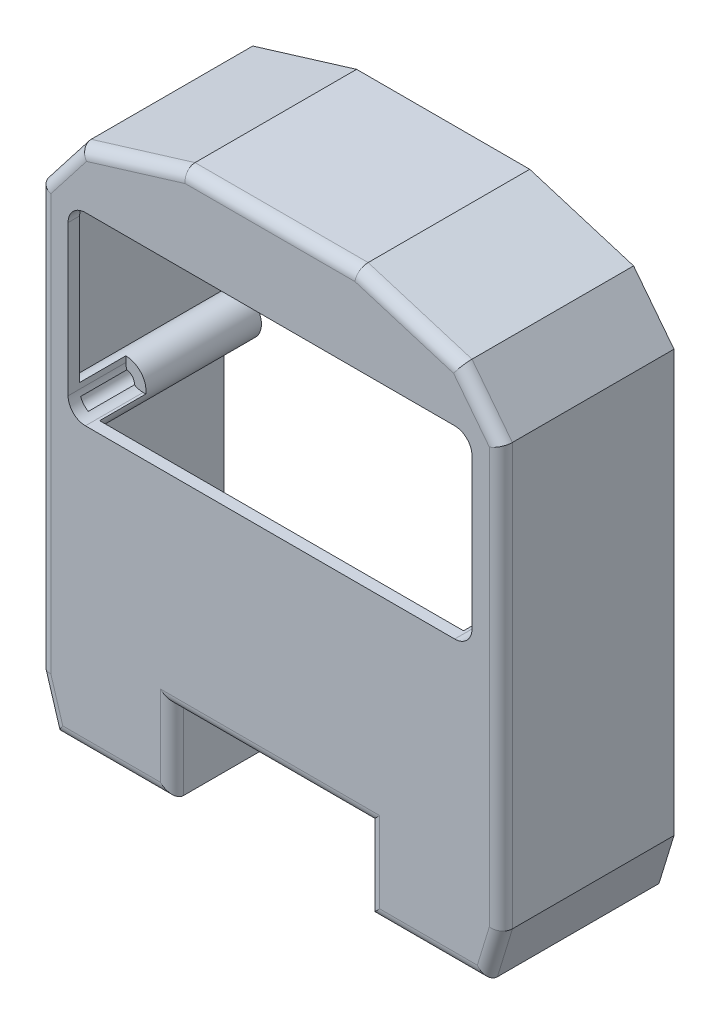
from build123d import *

# Parameters (mm, degrees)
EXTRUDE_1_DEPTH     = 30
FILLET_4_R          = 2
SKETCH_2_R          = 1.5
CUT_EXTRUDE_1_DEPTH = 28
SHELL_3_DEPTH       = 28
CUT_EXTRUDE_2_DEPTH = 10


# Read off the part's stored shape, not the designer's step: 抽壳3
with BuildPart() as part:
    # 草图1 → 凸台-拉伸1 (new body)
    with BuildSketch(Plane.XY):
        Polygon((-84.402777778, 44), (-87, 52.5), (-87, 125.5), (-80, 134.5), (-62, 140), (-32, 140), (-14, 134.5), (-7, 125.5), (-7, 52.5), (-9.597222222, 44), (-30, 44), (-30, 58), (-64, 58), (-64, 44), align=None)
    extrude(amount=EXTRUDE_1_DEPTH)

    # 圆角4
    fillet_4_edges = [part.edges().sort_by_distance(p)[0] for p in [
        (-47, 58, 30),
        (-30, 51, 30),
        (-19.798611111, 44, 30),
        (-8.298611111, 48.25, 30),
        (-7, 89, 30),
        (-10.5, 130, 30),
        (-23, 137.25, 30),
        (-47, 140, 30),
        (-71, 137.25, 30),
        (-83.5, 130, 30),
        (-74.201388889, 44, 30),
        (-87, 89, 30),
        (-85.701388889, 48.25, 30),
        (-64, 51, 30),
    ]]
    fillet(fillet_4_edges, radius=FILLET_4_R)

    # 草图2 → 切除-拉伸1 (cut)
    with BuildSketch(Plane(origin=(0, 0, 0), x_dir=(-1, 0, 0), z_dir=(0, 0, -1))):
        with Locations((82, 53.5)):
            Circle(SKETCH_2_R)
        with Locations((12, 53.5)):
            Circle(SKETCH_2_R)
        with Locations((12, 93.5)):
            Circle(SKETCH_2_R)
        with Locations((82, 93.5)):
            Circle(SKETCH_2_R)
        with Locations((78, 129.5)):
            Circle(SKETCH_2_R)
        with Locations((16, 129.5)):
            Circle(SKETCH_2_R)
    extrude(amount=-CUT_EXTRUDE_1_DEPTH, mode=Mode.SUBTRACT)

    # 抽壳3 outline → 抽壳3 (cut)
    with BuildSketch(Plane.XY):
        with BuildLine():
            Line((-9, 55.302775638), (-9, 91.697224362))
            ThreePointArc((-9, 91.697224362), (-15.5, 93.5), (-9, 95.302775638))
            Line((-9, 95.302775638), (-9, 124.8137845))
            Line((-9, 124.8137845), (-12.504644228, 129.31975565))
            ThreePointArc((-12.504644228, 129.31975565), (-18.560753547, 127.114095293), (-15.933003152, 132.999358716))
            Line((-15.933003152, 132.999358716), (-32.298738264, 138))
            Line((-32.298738264, 138), (-61.701261736, 138))
            Line((-61.701261736, 138), (-78.066996848, 132.999358716))
            ThreePointArc((-78.066996848, 132.999358716), (-75.439246453, 127.114095293), (-81.495355772, 129.31975565))
            Line((-81.495355772, 129.31975565), (-85, 124.8137845))
            Line((-85, 124.8137845), (-85, 95.302775638))
            ThreePointArc((-85, 95.302775638), (-78.5, 93.5), (-85, 91.697224362))
            Line((-85, 91.697224362), (-85, 55.302775638))
            ThreePointArc((-85, 55.302775638), (-78.528186006, 53.943291769), (-84.450768591, 51.001253651))
            Line((-84.450768591, 51.001253651), (-82.922607753, 46))
            Line((-82.922607753, 46), (-66, 46))
            Line((-66, 46), (-66, 60))
            Line((-66, 60), (-28, 60))
            Line((-28, 60), (-28, 46))
            Line((-28, 46), (-11.077392247, 46))
            Line((-11.077392247, 46), (-9.549231409, 51.001253651))
            ThreePointArc((-9.549231409, 51.001253651), (-15.471813994, 53.943291769), (-9, 55.302775638))
        make_face()
    extrude(amount=SHELL_3_DEPTH, mode=Mode.SUBTRACT)

    # 草图3 → 切除-拉伸2 (cut)
    with BuildSketch(Plane.XY.offset(30)):
        with BuildLine():
            Line((-79, 125), (-15, 125))
            ThreePointArc((-15, 125), (-12.878679656, 124.121320344), (-12, 122))
            Line((-12, 122), (-12, 96))
            ThreePointArc((-12, 96), (-12.878679656, 93.878679656), (-15, 93))
            Line((-15, 93), (-79, 93))
            ThreePointArc((-79, 93), (-81.121320344, 93.878679656), (-82, 96))
            Line((-82, 96), (-82, 122))
            ThreePointArc((-82, 122), (-81.121320344, 124.121320344), (-79, 125))
        make_face()
    extrude(amount=-CUT_EXTRUDE_2_DEPTH, mode=Mode.SUBTRACT)


solid = part.part
